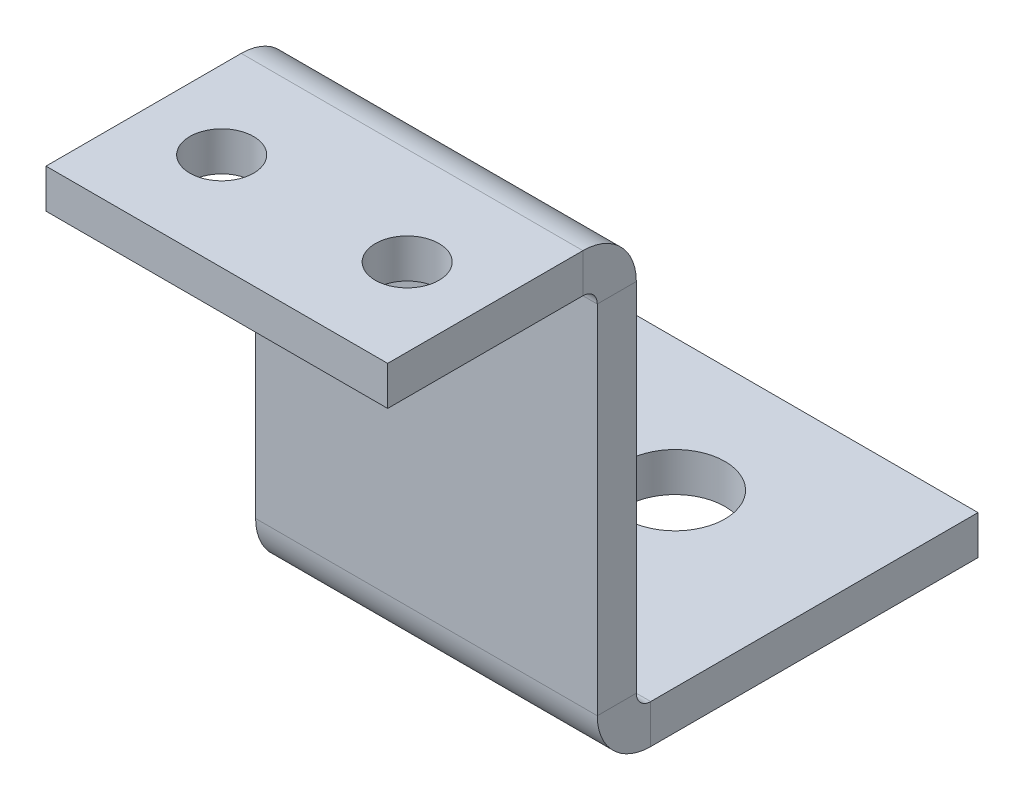
from build123d import *

# Parameters (mm, degrees)
SKETCH1_W                  = 17.5
SKETCH1_H                  = 10
BASE_FLANGE1_DEPTH         = 2
F_4_CLEARANCE_HOLE1_D      = 3.2639
F_4_CLEARANCE_HOLE1_DEPTH  = 2
F_4_CLEARANCE_HOLE1_TIP    = 0.980574487
EDGE_FLANGE1_DEPTH         = 17.5
EDGE_FLANGE2_DEPTH         = 17.5
F_10_CLEARANCE_HOLE1_D     = 5.1054
F_10_CLEARANCE_HOLE1_DEPTH = 2
F_10_CLEARANCE_HOLE1_TIP   = 1.533816902


# Sheet-metal steps are written as plain solids
with BuildPart() as part:
    # Sketch1 → Base-Flange1 (new body)
    with BuildSketch(Plane(origin=(0, 0, 0), x_dir=(1, 0, 0), z_dir=(0, 1, 0))):
        with Locations((-8.75, 5)):
            Rectangle(SKETCH1_W, SKETCH1_H)
    extrude(amount=-BASE_FLANGE1_DEPTH)

    # #4 Clearance Hole1
    with Locations(Plane.XZ.offset(2)):
        with Locations((-4, -5), (-13.5, -5)):
            Hole(F_4_CLEARANCE_HOLE1_D / 2, depth=F_4_CLEARANCE_HOLE1_DEPTH)
            with Locations((0, 0, -(F_4_CLEARANCE_HOLE1_DEPTH + F_4_CLEARANCE_HOLE1_TIP / 2))):  # 118° drill point
                Cone(0, F_4_CLEARANCE_HOLE1_D / 2, F_4_CLEARANCE_HOLE1_TIP, mode=Mode.SUBTRACT)

    # Edge-Flange1 section (across the edge) → Edge-Flange1 (add)
    with BuildSketch(Plane(origin=(-17.5, -2, -10.7366), x_dir=(0, 0, 1), z_dir=(1, 0, 0))):
        with BuildLine():
            Line((-2, 0.7366), (-2, 19))
            Line((-2, 19), (0, 19))
            Line((0, 19), (0, 0.7366))
            ThreePointArc((0, 0.7366), (0.215745145, 0.215745145), (0.7366, 0))
            Line((0.7366, 0), (0.7366, -2))
            ThreePointArc((0.7366, -2), (-1.198468417, -1.198468417), (-2, 0.7366))
        make_face()
    extrude(amount=EDGE_FLANGE1_DEPTH)

    # Edge-Flange2 section (across the edge) → Edge-Flange2 (add)
    with BuildSketch(Plane(origin=(0, -21.7366, -12.7366), x_dir=(0, 1, 0), z_dir=(-1, 0, 0))):
        with BuildLine():
            Line((-2, 0.7366), (-2, 17.5))
            Line((-2, 17.5), (0, 17.5))
            Line((0, 17.5), (0, 0.7366))
            ThreePointArc((0, 0.7366), (0.215745145, 0.215745145), (0.7366, 0))
            Line((0.7366, 0), (0.7366, -2))
            ThreePointArc((0.7366, -2), (-1.198468417, -1.198468417), (-2, 0.7366))
        make_face()
    extrude(amount=EDGE_FLANGE2_DEPTH)

    # #10 Clearance Hole1
    with Locations(Plane.XZ.offset(23.7366)):
        with Locations((-8.75, -23.4732)):
            Hole(F_10_CLEARANCE_HOLE1_D / 2, depth=F_10_CLEARANCE_HOLE1_DEPTH)
            with Locations((0, 0, -(F_10_CLEARANCE_HOLE1_DEPTH + F_10_CLEARANCE_HOLE1_TIP / 2))):  # 118° drill point
                Cone(0, F_10_CLEARANCE_HOLE1_D / 2, F_10_CLEARANCE_HOLE1_TIP, mode=Mode.SUBTRACT)


solid = part.part
